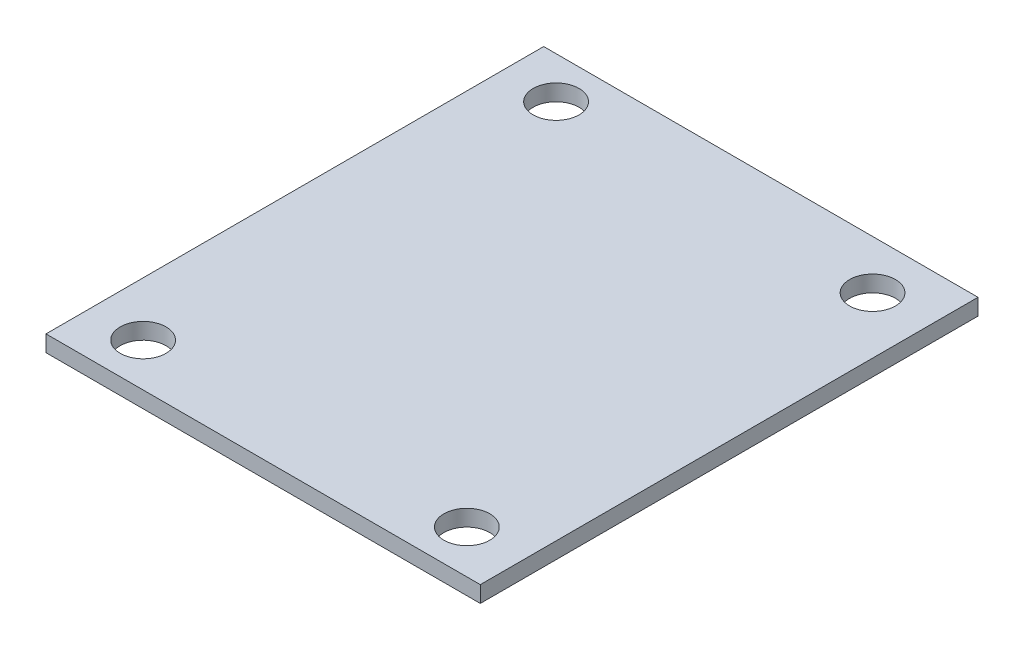
from build123d import *

# Parameters (mm, degrees)
SKETCH1_W                = 32.2
SKETCH1_H                = 36.9
BASE_FLANGE1_DEPTH       = 1.21
M3_CLEARANCE_HOLE1_D     = 3.4
M3_CLEARANCE_HOLE1_DEPTH = 3.34
M3_CLEARANCE_HOLE1_TIP   = 1.021463052


# Sheet-metal steps are written as plain solids
with BuildPart() as part:
    # Sketch1 → Base-Flange1 (new body)
    with BuildSketch(Plane(origin=(0, 0, 0), x_dir=(1, 0, 0), z_dir=(0, 1, 0))):
        Rectangle(SKETCH1_W, SKETCH1_H)
    extrude(amount=-BASE_FLANGE1_DEPTH)

    # M3 Clearance Hole1
    with Locations(Plane(origin=(0, -1.21, 0), x_dir=(-1, 0, 0), z_dir=(0, -1, 0))):
        with Locations((-11.9, -15.248294706), (12.1, -15.248294706), (12.1, 15.370879883), (-11.9, 14.832508941)):
            Hole(M3_CLEARANCE_HOLE1_D / 2, depth=M3_CLEARANCE_HOLE1_DEPTH)
            with Locations((0, 0, -(M3_CLEARANCE_HOLE1_DEPTH + M3_CLEARANCE_HOLE1_TIP / 2))):  # 118° drill point
                Cone(0, M3_CLEARANCE_HOLE1_D / 2, M3_CLEARANCE_HOLE1_TIP, mode=Mode.SUBTRACT)


solid = part.part
